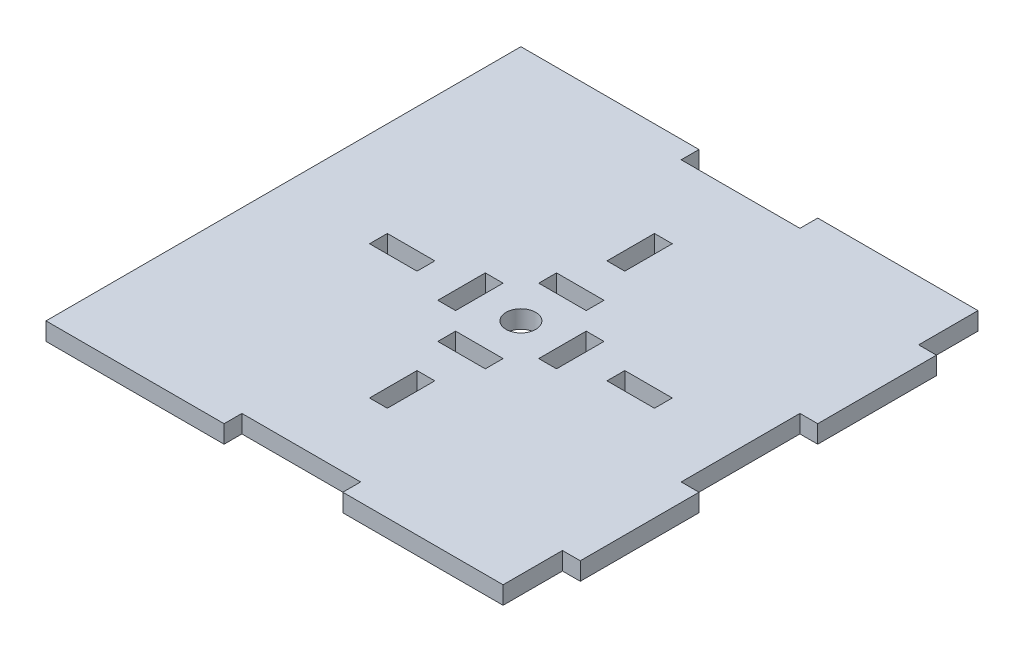
from build123d import *

# Parameters (mm, degrees)
CROQUIS1_R              = 2.5
SALIENTE_EXTRUIR1_DEPTH = 3


with BuildPart() as part:
    # Croquis1 → Saliente-Extruir1 (new body)
    with BuildSketch(Plane(origin=(0, 0, 0), x_dir=(1, 0, 0), z_dir=(0, 1, 0))):
        Polygon((-40, 40), (-10, 40), (-10, 37), (0, 37), (10, 37), (10, 40), (37, 40), (37, 30), (40, 30), (40, 10), (37, 10), (37, -10), (40, -10), (40, -30), (37, -30), (37, -40), (10, -40), (10, -37), (0, -37), (-10, -37), (-10, -40), (-40, -40), align=None)
        Circle(CROQUIS1_R, mode=Mode.SUBTRACT)
        Polygon((0, 10), (-4, 10), (-4, 7), (4, 7), (4, 10), align=None, mode=Mode.SUBTRACT)
        Polygon((7, 4), (7, -4), (10, -4), (10, 0), (10, 4), align=None, mode=Mode.SUBTRACT)
        Polygon((4, -7), (-4, -7), (-4, -10), (0, -10), (4, -10), align=None, mode=Mode.SUBTRACT)
        Polygon((-7, -4), (-7, 4), (-10, 4), (-10, 0), (-10, -4), align=None, mode=Mode.SUBTRACT)
        Polygon((20, 1.5), (16, 1.5), (16, -1.5), (24, -1.5), (24, 1.5), align=None, mode=Mode.SUBTRACT)
        Polygon((1.5, -20), (1.5, -16), (-1.5, -16), (-1.5, -24), (1.5, -24), align=None, mode=Mode.SUBTRACT)
        Polygon((-20, -1.5), (-16, -1.5), (-16, 1.5), (-24, 1.5), (-24, -1.5), align=None, mode=Mode.SUBTRACT)
        Polygon((-1.5, 20), (-1.5, 16), (1.5, 16), (1.5, 24), (-1.5, 24), align=None, mode=Mode.SUBTRACT)
    extrude(amount=SALIENTE_EXTRUIR1_DEPTH)


solid = part.part
